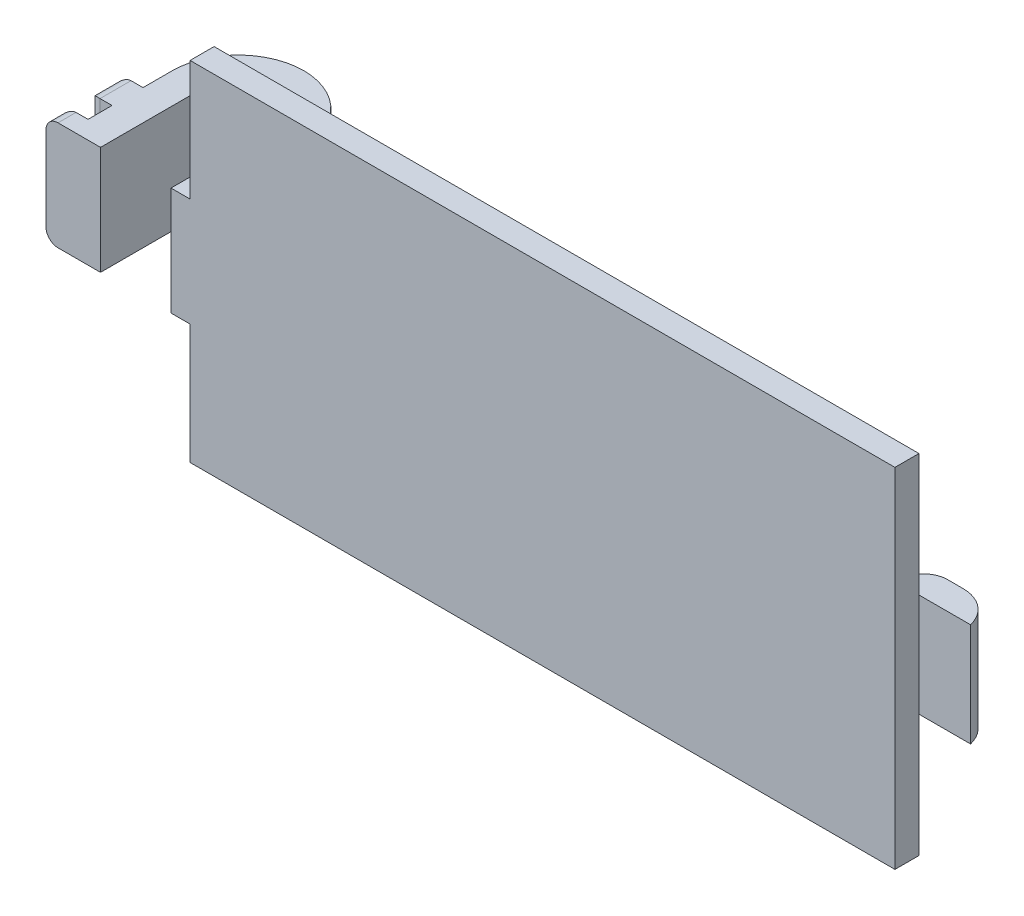
from build123d import *

# Parameters (mm, degrees)
SKETCH1_W           = 58.7
SKETCH1_H           = 14.5
BOSS_EXTRUDE1_DEPTH = 2
SKETCH2_W           = 1.907537222
SKETCH2_H           = 8.6
BOSS_EXTRUDE2_DEPTH = 4.3
SKETCH3_W           = 2.3
SKETCH3_H           = 8.6
BOSS_EXTRUDE3_DEPTH = 4.3
FILLET3_R           = 2
SKETCH4_W           = 0.949738238
SKETCH4_H           = 9
BOSS_EXTRUDE4_DEPTH = 12
SKETCH5_W           = 14
SKETCH5_H           = 9.016953004
BOSS_EXTRUDE5_DEPTH = 10
FILLET4_R           = 5.5
CUT_EXTRUDE1_DEPTH  = 12
SKETCH8_W           = 2.580145407
SKETCH8_H           = 9.016953004
SKETCH8_W_2         = 1.5
BOSS_EXTRUDE6_DEPTH = 2
SKETCH9_W           = 1.920869139
SKETCH9_H           = 1.685794619
SKETCH9_H_2         = 1.68579462
BOSS_EXTRUDE7_DEPTH = 3
FILLET6_R           = 3
FILLET9_R           = 3
FILLET11_R          = 1
FILLET12_R          = 1


with BuildPart() as part:
    # Sketch1 → Boss-Extrude1 (new body)
    with BuildSketch(Plane.XY):
        with Locations((15.900667763, -7.24741023)):
            Rectangle(SKETCH1_W, SKETCH1_H)
        with Locations((15.900667763, 7.25258977)):
            Rectangle(SKETCH1_W, SKETCH1_H)
    extrude(amount=BOSS_EXTRUDE1_DEPTH)

    # Sketch2 → Boss-Extrude2 (add)
    with BuildSketch(Plane.XY.offset(2)):
        with Locations((44.296899152, 0)):
            Rectangle(SKETCH2_W, SKETCH2_H)
    extrude(amount=-BOSS_EXTRUDE2_DEPTH)

    # Sketch3 → Boss-Extrude3 (add)
    with BuildSketch(Plane(origin=(45.250667763, 0, 0), x_dir=(0, 0, -1), z_dir=(1, 0, 0))):
        with Locations((1.15, 0)):
            Rectangle(SKETCH3_W, SKETCH3_H)
    extrude(amount=BOSS_EXTRUDE3_DEPTH)

    # Fillet3
    fillet3_edges = [part.edges().sort_by_distance(p)[0] for p in [
        (43.343130541, 0, -2.3),
    ]]
    fillet(fillet3_edges, radius=FILLET3_R)

    # Sketch4 → Boss-Extrude4 (add)
    with BuildSketch(Plane(origin=(0, 0, 0), x_dir=(-1, 0, 0), z_dir=(0, 0, -1))):
        with Locations((12.974463118, 0.00258977)):
            Rectangle(SKETCH4_W, SKETCH4_H)
    extrude(amount=BOSS_EXTRUDE4_DEPTH)

    # Sketch5 → Boss-Extrude5 (add)
    with BuildSketch(Plane.ZY.offset(13.449332237)):
        with Locations((-5, -0.005886732)):
            Rectangle(SKETCH5_W, SKETCH5_H)
    extrude(amount=BOSS_EXTRUDE5_DEPTH)

    # Fillet4
    # the kernel refuses this fillet: 5.5 mm, written as the material it takes off along each edge
    with BuildSketch(Plane(origin=(-23.449332237, -18.264363234, -12), x_dir=(1, 0, 0), z_dir=(0, 1, 0))) as fillet4_piece_1:
        with BuildLine():
            CenterArc((FILLET4_R, -FILLET4_R), FILLET4_R, 90, 90)
            Line((0, -FILLET4_R), (0, 0))
            Line((0, 0), (FILLET4_R, 0))
        make_face()
    extrude(amount=36.516953004, mode=Mode.SUBTRACT)
    with BuildSketch(Plane(origin=(-12.499593999, -18.24741023, -12), x_dir=(-1, 0, 0), z_dir=(0, 1, 0))) as fillet4_piece_2:
        with BuildLine():
            CenterArc((FILLET4_R, FILLET4_R), FILLET4_R, 180, 90)
            Line((0, FILLET4_R), (0, 0))
            Line((0, 0), (FILLET4_R, 0))
        make_face()
    extrude(amount=36.5, mode=Mode.SUBTRACT)

    # Sketch7 → Cut-Extrude1 (cut)
    with BuildSketch(Plane(origin=(0, 4.50258977, 0), x_dir=(1, 0, 0), z_dir=(0, 1, 0))):
        with BuildLine():
            ThreePointArc((-15.03934254, 6.5), (-17.974463118, 9.435120578), (-20.909583696, 6.5))
            Line((-20.909583696, 6.5), (-15.03934254, 6.5))
        make_face()
        with BuildLine():
            Line((-15.03934254, 6.5), (-20.909583696, 6.5))
            ThreePointArc((-20.909583696, 6.5), (-17.974463118, 3.564879422), (-15.03934254, 6.5))
        make_face()
        with BuildLine():
            ThreePointArc((-15.03934254, 6.5), (-17.974463118, 3.564879422), (-20.909583696, 6.5))
            Line((-20.909583696, 6.5), (-20.909583696, -2))
            Line((-20.909583696, -2), (-15.03934254, -2))
            Line((-15.03934254, -2), (-15.03934254, 6.5))
        make_face()
    extrude(amount=-CUT_EXTRUDE1_DEPTH, mode=Mode.SUBTRACT)

    # Sketch8 → Boss-Extrude6 (add)
    with BuildSketch(Plane.ZY.offset(23.449332237)):
        with Locations((-2.790072703, -0.005886732)):
            Rectangle(SKETCH8_W, SKETCH8_H)
        with Locations((1.25, -0.005886732)):
            Rectangle(SKETCH8_W_2, SKETCH8_H)
    extrude(amount=BOSS_EXTRUDE6_DEPTH)

    # Sketch9 → Boss-Extrude7 (add)
    with BuildSketch(Plane(origin=(0, 0, 0), x_dir=(-1, 0, 0), z_dir=(0, 0, -1))):
        with Locations((11.550124457, -3.589191377)):
            Rectangle(SKETCH9_W, SKETCH9_H)
        with Locations((11.539159429, 3.65969246)):
            Rectangle(SKETCH9_W, SKETCH9_H_2)
    extrude(amount=BOSS_EXTRUDE7_DEPTH)

    # Fillet6
    # the kernel refuses this fillet: 3 mm, written as the material it takes off along each edge
    with BuildSketch(Plane(origin=(-10.589689887, 4.241056538, -3), x_dir=(-1, 0, 0), z_dir=(0, -1, 0))) as fillet6_piece_1_section:
        with BuildLine():
            CenterArc((3, -2.794940242), FILLET6_R, 111.307014795, 68.692985205)
            Line((0, -2.794940242), (0, 0))
            Line((0, 0), (1.909904112, 0))
        make_face()
    fillet6_piece_1 = extrude(amount=15.660495829, mode=Mode.PRIVATE)
    fillet6_piece_1 = split(fillet6_piece_1, bisect_by=Plane(origin=(-11.107813793, 2.81679515, -1.901033535), z_dir=(0, -1, 0)), keep=Keep.TOP, mode=Mode.PRIVATE)
    add(fillet6_piece_1, mode=Mode.SUBTRACT)
    with BuildSketch(Plane(origin=(-10.57872486, 11.500570097, -3), x_dir=(-1, 0, 0), z_dir=(0, -1, 0))) as fillet6_piece_2:
        with BuildLine():
            CenterArc((3, -2.799192131), FILLET6_R, 111.082404826, 68.917595174)
            Line((0, -2.799192131), (0, 0))
            Line((0, 0), (1.920869139, 0))
        make_face()
    extrude(amount=15.681755273, mode=Mode.SUBTRACT)

    # Fillet9
    # the kernel refuses this fillet: 3 mm, written as the material it takes off along each edge
    with BuildSketch(Plane(origin=(49.550667763, 11.592976073, -2.3), x_dir=(-1, 0, 0), z_dir=(0, -1, 0))) as fillet9_piece_1:
        with BuildLine():
            CenterArc((2.917190429, -3), FILLET9_R, 90, 76.506601178)
            Line((0, -2.3), (-0.058343809, -2.286))
            ThreePointArc((-0.058343809, -2.286), (-0.06, -1.15), (-0.06, 0))
            Line((-0.06, 0), (0, 0.06))
            Line((0, 0.06), (2.917190429, 0.06))
            Line((2.917190429, 0.06), (2.917190429, 0))
        make_face()
    extrude(amount=23.185952146, mode=Mode.SUBTRACT)

    # Fillet11
    fillet11_edges = [part.edges().sort_by_distance(p)[0] for p in [
        (-25.449332237, -0.005886732, -4.080145407),
        (-25.449332237, -4.514363234, -2.790072704),
        (-25.449332237, -0.005886732, -1.5),
        (-25.449332237, 4.50258977, -2.790072704),
    ]]
    fillet(fillet11_edges, radius=FILLET11_R)

    # Fillet12
    fillet12_edges = [part.edges().sort_by_distance(p)[0] for p in [
        (-25.449332237, 4.50258977, 1.25),
        (-25.449332237, -0.005886732, 0.5),
        (-25.449332237, -4.514363234, 1.25),
    ]]
    fillet(fillet12_edges, radius=FILLET12_R)


solid = part.part
